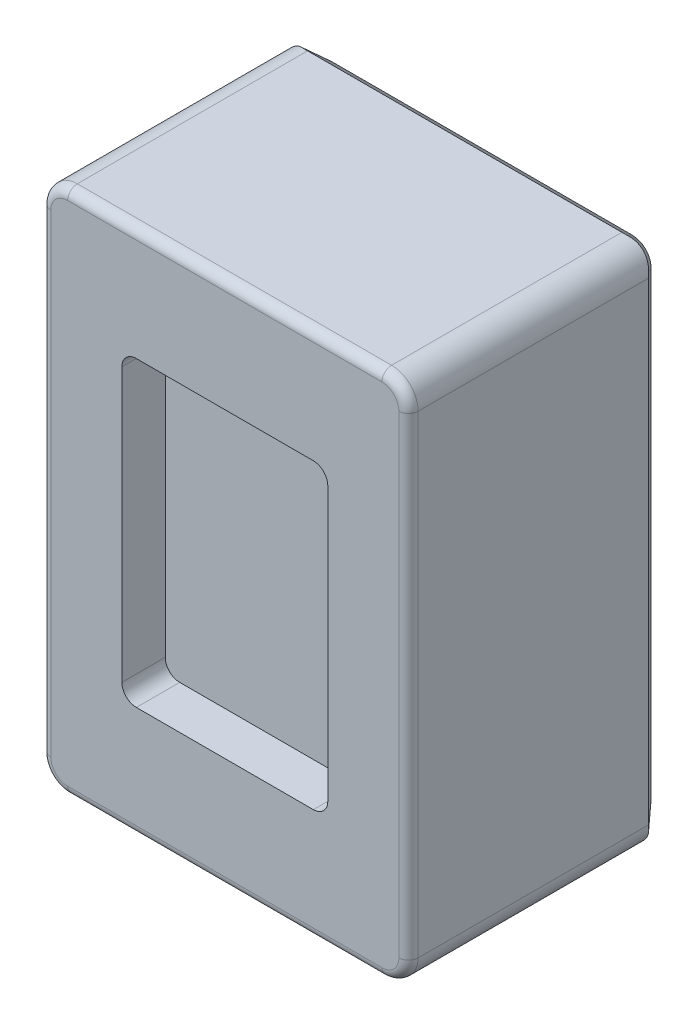
from build123d import *

# Parameters (mm, degrees)
SKETCH2_W           = 76.2
SKETCH2_H           = 109.22
BOSS_EXTRUDE1_DEPTH = 53.34
CHAMFER1_SIZE       = 3
CHAMFER1_SIZE2      = 3.575260778
CHAMFER2_SIZE       = 3
CHAMFER2_SIZE2      = 3.575260778
FILLET2_R           = 5.5
FILLET3_R           = 5.5
FILLET4_R           = 2
CUT_EXTRUDE1_DEPTH  = 9
CUT_EXTRUDE2_DEPTH  = 3


with BuildPart() as part:
    # Sketch2 → Boss-Extrude1 (new body)
    with BuildSketch(Plane.XY):
        with Locations((38.1, 54.61)):
            Rectangle(SKETCH2_W, SKETCH2_H)
    extrude(amount=BOSS_EXTRUDE1_DEPTH)

    # Chamfer1
    chamfer1_edges = [part.edges().sort_by_distance(p)[0] for p in [
        (38.1, 109.22, 0),
    ]]
    chamfer1_side = [part.faces().sort_by_distance(p)[0] for p in [
        (38.1, 54.61, 0),
    ]]
    chamfer(chamfer1_edges, length=CHAMFER1_SIZE, length2=CHAMFER1_SIZE2, reference=chamfer1_side[0])

    # Chamfer2
    chamfer2_edges = [part.edges().sort_by_distance(p)[0] for p in [
        (0, 53.11, 0),
        (38.1, 0, 0),
        (76.2, 53.11, 0),
    ]]
    chamfer2_side = [part.faces().sort_by_distance(p)[0] for p in [
        (38.1, 53.11, 0),
    ]]
    chamfer(chamfer2_edges, length=CHAMFER2_SIZE, length2=CHAMFER2_SIZE2, reference=chamfer2_side[0])

    # Fillet2
    fillet2_edges = [part.edges().sort_by_distance(p)[0] for p in [
        (74.7, 107.72, 1.787630389),
        (1.5, 107.72, 1.787630389),
        (74.7, 1.5, 1.787630389),
        (1.5, 1.5, 1.787630389),
    ]]
    fillet(fillet2_edges, radius=FILLET2_R)

    # Fillet3
    fillet3_edges = [part.edges().sort_by_distance(p)[0] for p in [
        (76.2, 0, 29.139633853),
        (0, 0, 29.139633853),
        (0, 109.22, 29.139633853),
        (76.2, 109.22, 29.139633853),
    ]]
    fillet(fillet3_edges, radius=FILLET3_R - 0.0001)  # a hair under: the kernel refuses the full size

    # Fillet4
    fillet4_edges = [part.edges().sort_by_distance(p)[0] for p in [
        (76.2, 54.61, 53.34),
        (38.1, 0, 53.34),
        (0, 54.61, 53.34),
        (38.1, 109.22, 53.34),
        (74.589116586, 107.609116586, 53.34),
        (1.610883414, 107.609116586, 53.34),
        (1.610883414, 1.610883414, 53.34),
        (74.589116586, 1.610883414, 53.34),
    ]]
    fillet(fillet4_edges, radius=FILLET4_R)

    # Sketch4 → Cut-Extrude1 (cut)
    with BuildSketch(Plane.XY.offset(53.34)):
        with BuildLine():
            Line((19.741636299, 85.947770103), (56.458363701, 85.947770103))
            ThreePointArc((56.458363701, 85.947770103), (58.579684045, 85.069090446), (59.458363701, 82.947770103))
            Line((59.458363701, 82.947770103), (59.458363701, 26.272229897))
            ThreePointArc((59.458363701, 26.272229897), (58.579684045, 24.150909554), (56.458363701, 23.272229897))
            Line((56.458363701, 23.272229897), (19.741636299, 23.272229897))
            ThreePointArc((19.741636299, 23.272229897), (17.620315955, 24.150909554), (16.741636299, 26.272229897))
            Line((16.741636299, 26.272229897), (16.741636299, 82.947770103))
            ThreePointArc((16.741636299, 82.947770103), (17.620315955, 85.069090446), (19.741636299, 85.947770103))
        make_face()
    extrude(amount=-CUT_EXTRUDE1_DEPTH, mode=Mode.SUBTRACT)

    # Sketch5 → Cut-Extrude2 (cut)
    with BuildSketch(Plane.XZ):
        with BuildLine():
            Line((14.6, 36.34), (61.6, 36.34))
            ThreePointArc((61.6, 36.34), (62.660660172, 36.779339828), (63.1, 37.84))
            Line((63.1, 37.84), (63.1, 44.84))
            ThreePointArc((63.1, 44.84), (62.660660172, 45.900660172), (61.6, 46.34))
            Line((61.6, 46.34), (14.6, 46.34))
            ThreePointArc((14.6, 46.34), (13.539339828, 45.900660172), (13.1, 44.84))
            Line((13.1, 44.84), (13.1, 37.84))
            ThreePointArc((13.1, 37.84), (13.539339828, 36.779339828), (14.6, 36.34))
        make_face()
    extrude(amount=-CUT_EXTRUDE2_DEPTH, mode=Mode.SUBTRACT)


solid = part.part
